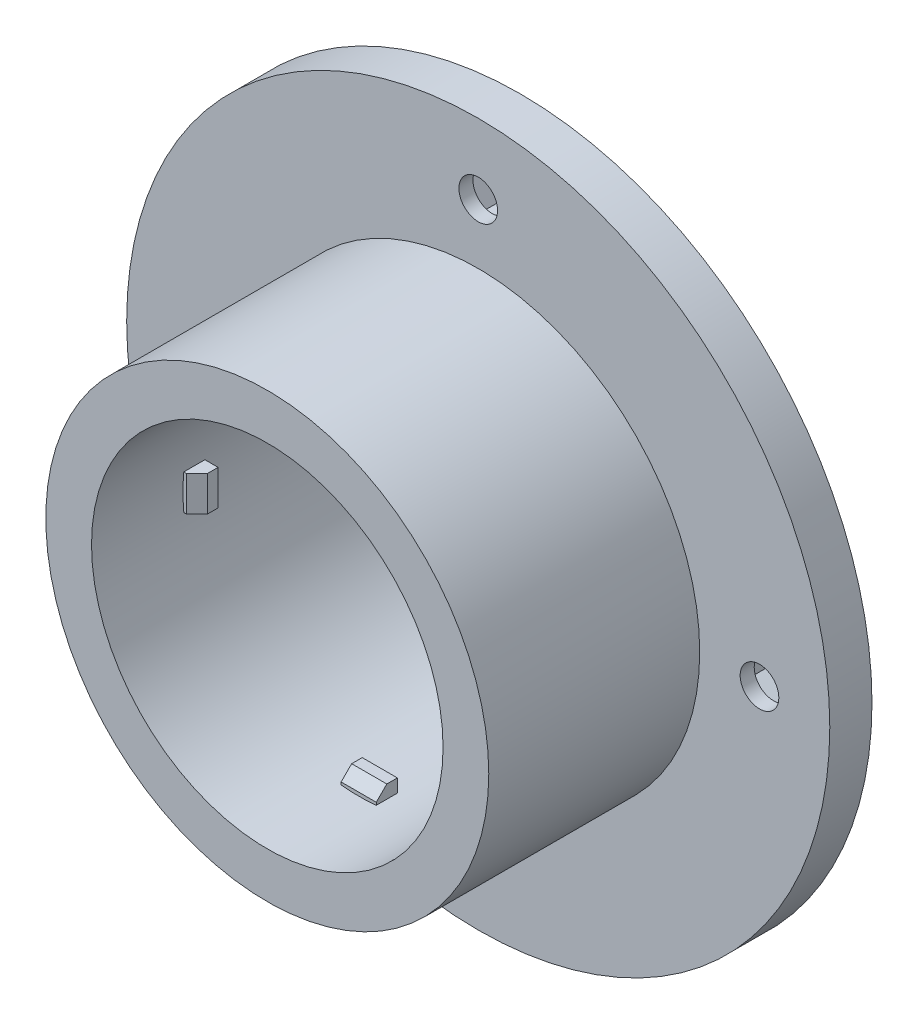
from build123d import *

# Parameters (mm, degrees)
SZKIC1_R                         = 50
DODANIE_WYCI_GNI_CIE1_DEPTH      = 6
SZKIC2_R                         = 31.5
DODANIE_WYCI_GNI_CIE2_DEPTH      = 30
SZKIC3_R                         = 25
WYTNIJ_WYCI_GNI_CIE1_DEPTH       = 80.3473377
SZKIC4_W                         = 5
SZKIC4_H                         = 5
DODANIE_WYCI_GNI_CIE3_DEPTH      = 3
SFAZOWANIE2_SIZE                 = 1.5
SZYK_KO_OWY3_COUNT               = 4
SFAZOWANIE2_OF_SZYK_KO_OWY3_SIZE = 1.5
WYTNIJ_WYCI_GNI_CIE2_DEPTH       = 4
SZKIC6_R                         = 2.75
WYTNIJ_WYCI_GNI_CIE3_DEPTH       = 78.614431648


with BuildPart() as part:
    # Szkic1 → Dodanie-wyciągnięcie1 (new body)
    with BuildSketch(Plane.XY):
        Circle(SZKIC1_R)
    extrude(amount=DODANIE_WYCI_GNI_CIE1_DEPTH)

    # Szkic2 → Dodanie-wyciągnięcie2 (add)
    with BuildSketch(Plane.XY.offset(6)):
        Circle(SZKIC2_R)
    extrude(amount=DODANIE_WYCI_GNI_CIE2_DEPTH)

    # Szkic3 → Wytnij-wyciągnięcie1 (cut, through all)
    with BuildSketch(Plane.XY.offset(36)):
        Circle(SZKIC3_R)
    extrude(amount=-WYTNIJ_WYCI_GNI_CIE1_DEPTH, mode=Mode.SUBTRACT)

    # Szkic4 → Dodanie-wyciągnięcie3 (add)
    with BuildSketch(Plane.XY.offset(20)):
        with Locations((0, 25.5)):
            Rectangle(SZKIC4_W, SZKIC4_H)
    dodanie_wyci_gni_cie3 = extrude(amount=DODANIE_WYCI_GNI_CIE3_DEPTH)

    # Sfazowanie2
    sfazowanie2_edges = [part.edges().sort_by_distance(p)[0] for p in [
        (0, 23, 23),
    ]]
    chamfer(sfazowanie2_edges, length=SFAZOWANIE2_SIZE)

    # Szyk kołowy3: Dodanie-wyciągnięcie3 ×4 about axis
    szyk_ko_owy3_axis = Axis((0, 0, 36), (0, 0, 1))
    for i in range(1, SZYK_KO_OWY3_COUNT):
        add(dodanie_wyci_gni_cie3.rotate(szyk_ko_owy3_axis, i * 360 / SZYK_KO_OWY3_COUNT))

    # Sfazowanie2 of Szyk kołowy3
    sfazowanie2_of_szyk_ko_owy3_edges = [part.edges().sort_by_distance(p)[0] for p in [
        (-23, 0, 23),
        (0, -23, 23),
        (23, 0, 23),
    ]]
    chamfer(sfazowanie2_of_szyk_ko_owy3_edges, length=SFAZOWANIE2_OF_SZYK_KO_OWY3_SIZE)

    # Szkic5 → Wytnij-wyciągnięcie2 (cut)
    with BuildSketch(Plane(origin=(0, 0, 0), x_dir=(-1, 0, 0), z_dir=(0, 0, -1))):
        Polygon((40, -4.907477288), (44.25, -2.453738644), (44.25, 2.453738644), (40, 4.907477288), (35.75, 2.453738644), (35.75, -2.453738644), align=None)
        Polygon((4.907477288, 40), (2.453738644, 44.25), (-2.453738644, 44.25), (-4.907477288, 40), (-2.453738644, 35.75), (2.453738644, 35.75), align=None)
        Polygon((-4.907477288, -40), (-2.453738644, -44.25), (2.453738644, -44.25), (4.907477288, -40), (2.453738644, -35.75), (-2.453738644, -35.75), align=None)
        Polygon((-40, 4.907477288), (-44.25, 2.453738644), (-44.25, -2.453738644), (-40, -4.907477288), (-35.75, -2.453738644), (-35.75, 2.453738644), align=None)
    extrude(amount=-WYTNIJ_WYCI_GNI_CIE2_DEPTH, mode=Mode.SUBTRACT)

    # Szkic6 → Wytnij-wyciągnięcie3 (cut, through all)
    with BuildSketch(Plane(origin=(0, 0, 4), x_dir=(-1, 0, 0), z_dir=(0, 0, -1))):
        with Locations((0, 40)):
            Circle(SZKIC6_R)
        with Locations((40, 0)):
            Circle(SZKIC6_R)
        with Locations((0, -40)):
            Circle(SZKIC6_R)
        with Locations((-40, 0)):
            Circle(SZKIC6_R)
    extrude(amount=-WYTNIJ_WYCI_GNI_CIE3_DEPTH, mode=Mode.SUBTRACT)


solid = part.part
